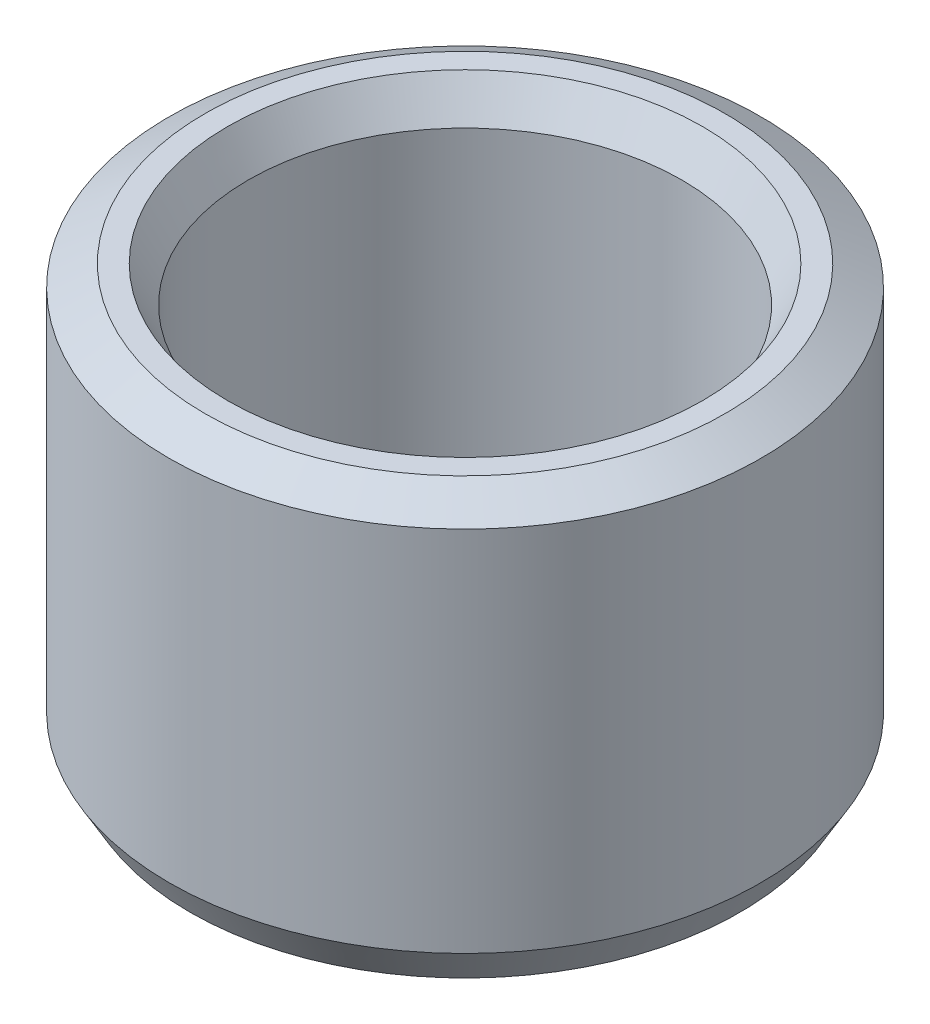
from build123d import *
from OCP.BRepFilletAPI import BRepFilletAPI_MakeChamfer

# Parameters (mm, degrees)
SKETCH1_R           = 52.5
BOSS_EXTRUDE1_DEPTH = 75.249700574
SKETCH2_R           = 38.456626533
CUT_EXTRUDE1_DEPTH  = 106.711955031
CHAMFER1_SIZE       = 3.676289976
CHAMFER1_SIZE2      = 6.367521021


with BuildPart() as part:
    # Sketch1 → Boss-Extrude1 (new body)
    with BuildSketch(Plane(origin=(0, 0, 0), x_dir=(1, 0, 0), z_dir=(0, 1, 0))):
        Circle(SKETCH1_R)
    extrude(amount=BOSS_EXTRUDE1_DEPTH)

    # Sketch2 → Cut-Extrude1 (cut, through all)
    with BuildSketch(Plane(origin=(0, 0, 0), x_dir=(1, 0, 0), z_dir=(0, 1, 0))):
        Circle(SKETCH2_R)
    extrude(amount=CUT_EXTRUDE1_DEPTH, mode=Mode.SUBTRACT)

    # Chamfer1: one chamfer whose edges measure the first distance from different faces: ONE call of the kernel's chamfer builder (chamfer() names one face for all edges)
    chamfer1_edges_1 = [part.edges().sort_by_distance(p)[0] for p in [
        (-38.456626533, 75.249700574, 0),
    ]]
    chamfer1_side_1 = [part.faces().sort_by_distance(p)[0] for p in [
        (-51.01507576, 75.249700574, 0),
    ]]
    chamfer1_edges_2 = [part.edges().sort_by_distance(p)[0] for p in [
        (-38.456626533, 0, 0),
    ]]
    chamfer1_side_2 = [part.faces().sort_by_distance(p)[0] for p in [
        (-38.456626533, 37.624850287, 0),
    ]]
    chamfer1_edges_3 = [part.edges().sort_by_distance(p)[0] for p in [
        (-52.5, 0, 0),
    ]]
    chamfer1_side_3 = [part.faces().sort_by_distance(p)[0] for p in [
        (-51.01507576, 0, 0),
    ]]
    chamfer1_edges_4 = [part.edges().sort_by_distance(p)[0] for p in [
        (-52.5, 75.249700574, 0),
    ]]
    chamfer1_side_4 = [part.faces().sort_by_distance(p)[0] for p in [
        (-52.5, 37.624850287, 0),
    ]]
    chamfer1 = BRepFilletAPI_MakeChamfer(part.part.solid().wrapped)
    for e in chamfer1_edges_1:
        chamfer1.Add(CHAMFER1_SIZE, CHAMFER1_SIZE2, e.wrapped, chamfer1_side_1[0].wrapped)  # the first distance lies on this face
    for e in chamfer1_edges_2:
        chamfer1.Add(CHAMFER1_SIZE, CHAMFER1_SIZE2, e.wrapped, chamfer1_side_2[0].wrapped)  # the first distance lies on this face
    for e in chamfer1_edges_3:
        chamfer1.Add(CHAMFER1_SIZE, CHAMFER1_SIZE2, e.wrapped, chamfer1_side_3[0].wrapped)  # the first distance lies on this face
    for e in chamfer1_edges_4:
        chamfer1.Add(CHAMFER1_SIZE, CHAMFER1_SIZE2, e.wrapped, chamfer1_side_4[0].wrapped)  # the first distance lies on this face
    add(Compound.cast(chamfer1.Shape()), mode=Mode.REPLACE)


solid = part.part
